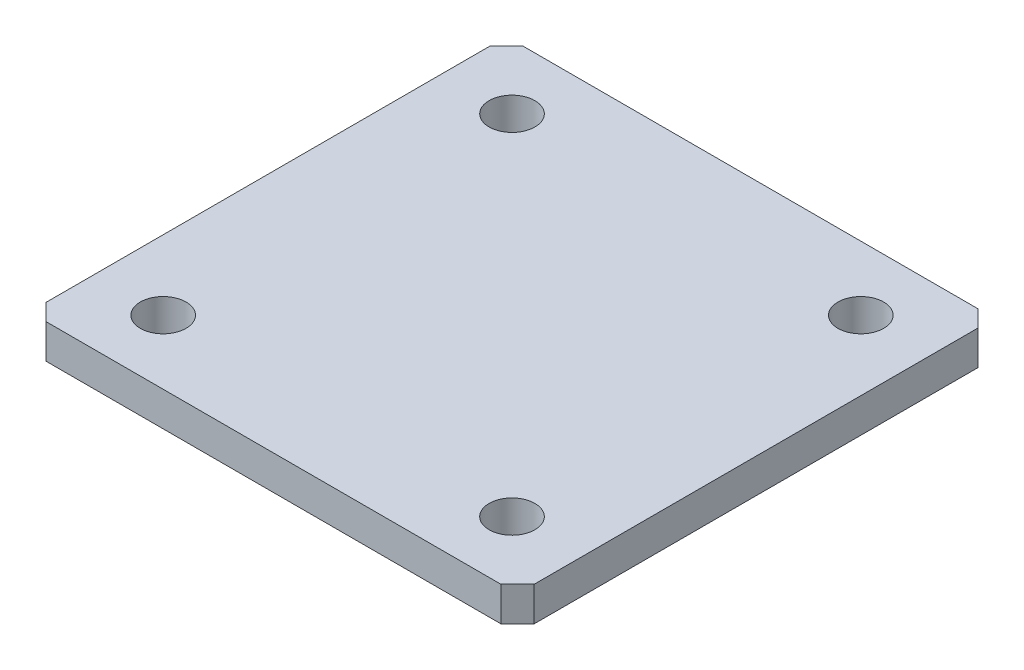
from build123d import *

# Parameters (mm, degrees)
SKETCH_1_R      = 2
EXTRUDE_1_DEPTH = 3


with BuildPart() as part:
    # 草图1 → 凸台-拉伸1 (new body)
    with BuildSketch(Plane(origin=(0, 0, 0), x_dir=(1, 0, 0), z_dir=(0, 1, 0))):
        Polygon((-19.887274719, -20.85738568), (19.887274719, -20.85738568), (21.342441161, -19.402219238), (21.342441161, 19.402219238), (19.887274719, 20.85738568), (-19.887274719, 20.85738568), (-21.342441161, 19.402219238), (-21.342441161, -19.402219238), align=None)
        with Locations((15.25, 15.25)):
            Circle(SKETCH_1_R, mode=Mode.SUBTRACT)
        with Locations((-15.25, 15.25)):
            Circle(SKETCH_1_R, mode=Mode.SUBTRACT)
        with Locations((15.25, -15.25)):
            Circle(SKETCH_1_R, mode=Mode.SUBTRACT)
        with Locations((-15.25, -15.25)):
            Circle(SKETCH_1_R, mode=Mode.SUBTRACT)
    extrude(amount=EXTRUDE_1_DEPTH)


solid = part.part
